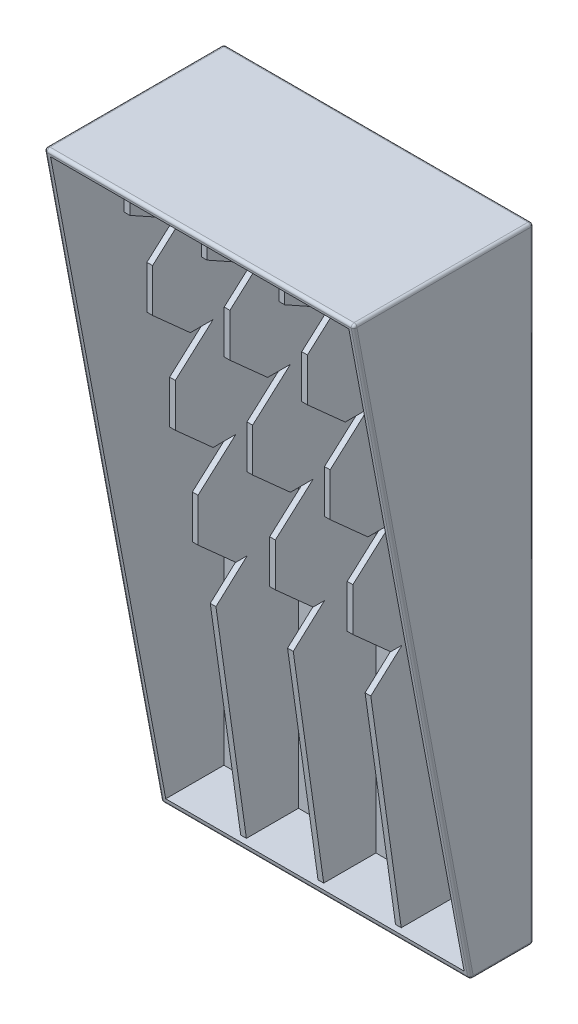
from build123d import *

# Parameters (mm, degrees)
CROSS_SECTION_EXTRUDE_DEPTH      = 545
OUTER_SHELL_T                    = -10
MID_DIVIDER_EXTRUDE_DEPTH        = 5
MID_DIVIDER_EXTRUDE_DEPTH_BACK   = 5
FIRST_DIVIDER_EXTRUDE_DEPTH      = 5
FIRST_DIVIDER_EXTRUDE_DEPTH_BACK = 5
THIRD_DIVIDER_EXTRUDE_DEPTH      = 5
THIRD_DIVIDER_EXTRUDE_DEPTH_BACK = 5
OUTER_FILLET_R                   = 5


with BuildPart() as part:
    # Cross Section Sketch → Cross Section Extrude (new body)
    with BuildSketch(Plane(origin=(0, 0, 0), x_dir=(0, 0, -1), z_dir=(1, 0, 0))):
        Polygon((0, 550), (0, -550), (-110.5, -550), (-317, 550), align=None)
    extrude(amount=CROSS_SECTION_EXTRUDE_DEPTH)

    # Outer Shell
    outer_shell_openings = [part.faces().sort_by_distance(p)[0] for p in [
        (272.5, 0, 213.75),
    ]]
    offset(amount=OUTER_SHELL_T, openings=outer_shell_openings, kind=Kind.INTERSECTION)

    # Tall Housing Sketch → Mid Divider Extrude (add, two sides: drawn at the far end of the back side and taken through both)
    with BuildSketch(Plane(origin=(272.5, 0, 0), x_dir=(0, 0, -1), z_dir=(1, 0, 0)).offset(-MID_DIVIDER_EXTRUDE_DEPTH_BACK)):
        Polygon((-100.5, -550), (0, -550), (0, 550), (-307, 550), (-307, 512), (-240.5, 475), (-200.5, 475), (-267, 415.5), (-267, 339.5), (-200.5, 280), (-160.5, 280), (-227, 220.5), (-227, 144.5), (-160.5, 85), (-120.5, 85), (-187, 25.5), (-187, -50.5), (-120.5, -110), (-100.5, -110), (-155.5, -160), align=None)
    extrude(amount=MID_DIVIDER_EXTRUDE_DEPTH + MID_DIVIDER_EXTRUDE_DEPTH_BACK)

    # Tall Housing Copy - First Plane → First Divider Extrude (add, two sides: drawn at the far end of the back side and taken through both)
    with BuildSketch(Plane(origin=(136.25, 0, 0), x_dir=(0, 0, -1), z_dir=(1, 0, 0)).offset(-FIRST_DIVIDER_EXTRUDE_DEPTH_BACK)):
        Polygon((-100.325318045, -550), (0, -550), (0, 550), (-306.825318045, 550), (-306.825318045, 512), (-240.325318045, 475), (-200.325318045, 475), (-266.825318045, 415.5), (-266.825318045, 339.5), (-200.325318045, 280), (-160.325318045, 280), (-226.825318045, 220.5), (-226.825318045, 144.5), (-160.325318045, 85), (-120.325318045, 85), (-186.825318045, 25.5), (-186.825318045, -50.5), (-120.325318045, -110), (-100.325318045, -110), (-155.325318045, -160), align=None)
    extrude(amount=FIRST_DIVIDER_EXTRUDE_DEPTH + FIRST_DIVIDER_EXTRUDE_DEPTH_BACK)

    # Tall Housing Copy - Third Plane → Third Divider Extrude (add, two sides: drawn at the far end of the back side and taken through both)
    with BuildSketch(Plane(origin=(408.75, 0, 0), x_dir=(0, 0, -1), z_dir=(1, 0, 0)).offset(-THIRD_DIVIDER_EXTRUDE_DEPTH_BACK)):
        Polygon((-100.325318045, -550), (0, -550), (0, 550), (-306.825318045, 550), (-306.825318045, 512), (-240.325318045, 475), (-200.325318045, 475), (-266.825318045, 415.5), (-266.825318045, 339.5), (-200.325318045, 280), (-160.325318045, 280), (-226.825318045, 220.5), (-226.825318045, 144.5), (-160.325318045, 85), (-120.325318045, 85), (-186.825318045, 25.5), (-186.825318045, -50.5), (-120.325318045, -110), (-100.325318045, -110), (-155.325318045, -160), align=None)
    extrude(amount=THIRD_DIVIDER_EXTRUDE_DEPTH + THIRD_DIVIDER_EXTRUDE_DEPTH_BACK)

    # Outer Fillet
    outer_fillet_edges = [part.edges().sort_by_distance(p)[0] for p in [
        (272.5, -550, 110.5),
        (272.5, -550, 0),
        (272.5, 550, 0),
        (272.5, 550, 317),
        (0, 0, 213.75),
        (0, -550, 55.25),
        (0, 0, 0),
        (0, 550, 158.5),
        (545, 0, 0),
        (545, -550, 55.25),
        (545, 0, 213.75),
        (545, 550, 158.5),
    ]]
    fillet(outer_fillet_edges, radius=OUTER_FILLET_R)


solid = part.part
